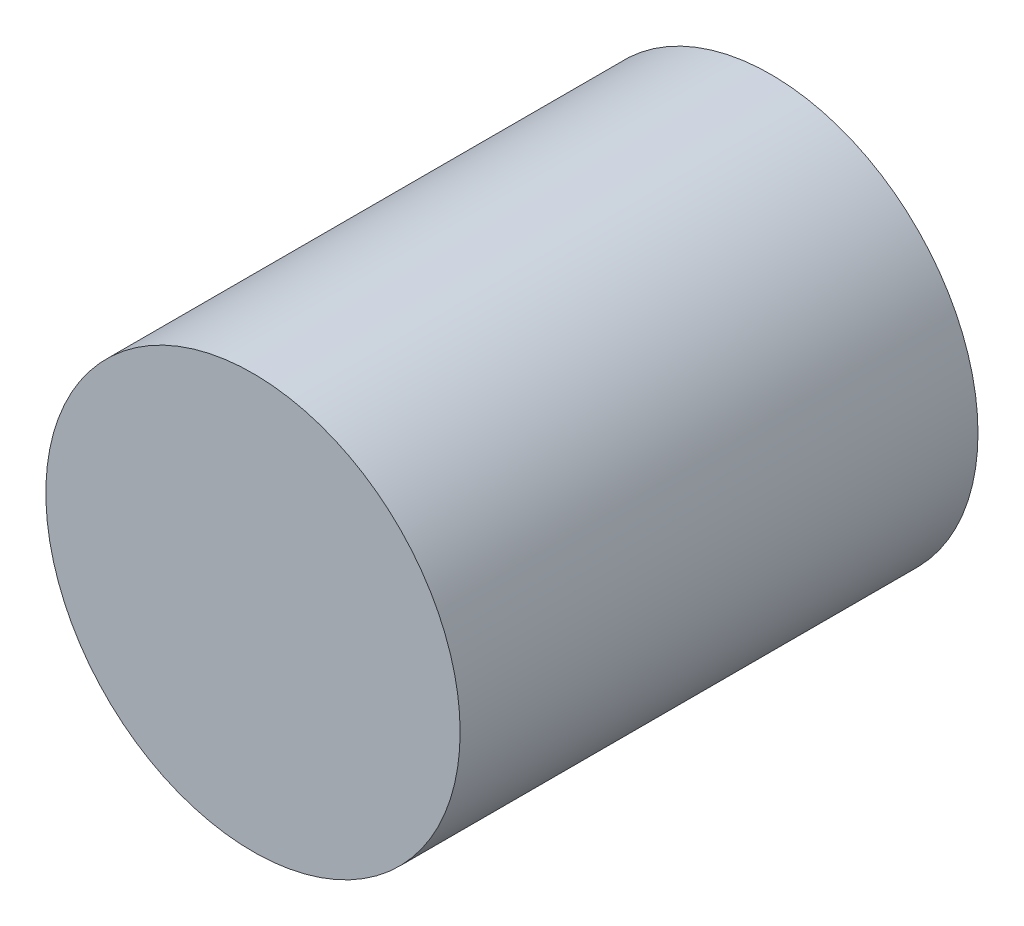
from build123d import *

# Parameters (mm, degrees)
SKETCH_1_R      = 20
EXTRUDE_1_DEPTH = 50


with BuildPart() as part:
    # 草图1 → 凸台-拉伸1 (new body)
    with BuildSketch(Plane.XY):
        Circle(SKETCH_1_R)
    extrude(amount=EXTRUDE_1_DEPTH)


solid = part.part
